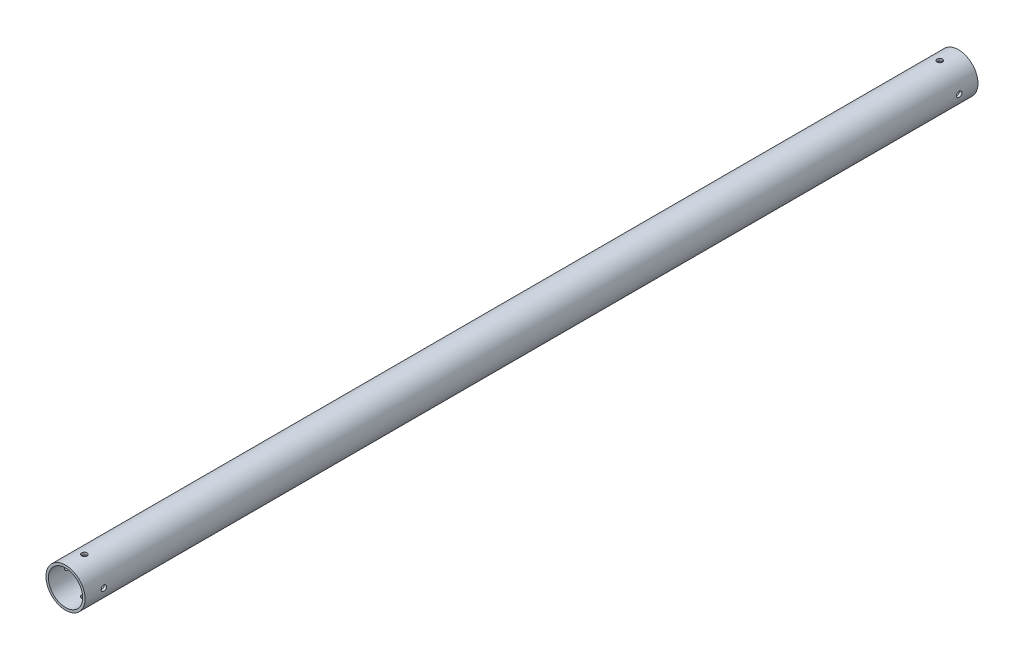
from build123d import *

# Parameters (mm, degrees)
SKETCH2_R               = 12.7
SKETCH2_R_2             = 11.1125
BOSS_EXTRUDE1_DEPTH     = 289.593629981
CUT_EXTRUDE1_DEPTH      = 291.150048295
CUT_EXTRUDE1_DEPTH_BACK = 291.150048295
SKETCH3_R               = 1.7526
CUT_EXTRUDE2_DEPTH      = 291.150048405
CUT_EXTRUDE2_DEPTH_BACK = 291.150048405
SKETCH5_R               = 1.7526


with BuildPart() as part:
    # Sketch2 → Boss-Extrude1 (new, symmetric)
    with BuildSketch(Plane.XY):
        Circle(SKETCH2_R)
        Circle(SKETCH2_R_2, mode=Mode.SUBTRACT)
    extrude(amount=BOSS_EXTRUDE1_DEPTH, both=True)

    # Sketch3 → Cut-Extrude1 (cut, two sides: drawn at the far end of the back side and taken through both)
    with BuildSketch(Plane(origin=(0, 0, 0), x_dir=(1, 0, 0), z_dir=(0, 1, 0)).offset(-CUT_EXTRUDE1_DEPTH_BACK)):
        with Locations((0, 277.401629981)):
            Circle(SKETCH3_R)
        with Locations((0, -277.401629981)):
            Circle(SKETCH3_R)
    extrude(amount=CUT_EXTRUDE1_DEPTH + CUT_EXTRUDE1_DEPTH_BACK, mode=Mode.SUBTRACT)

    # Sketch5 → Cut-Extrude2 (cut, two sides: drawn at the far end of the back side and taken through both)
    with BuildSketch(Plane(origin=(0, 0, 0), x_dir=(0, 0, -1), z_dir=(1, 0, 0)).offset(-CUT_EXTRUDE2_DEPTH_BACK)):
        with Locations((277.401629981, 0)):
            Circle(SKETCH5_R)
        with Locations((-277.401629981, 0)):
            Circle(SKETCH5_R)
    extrude(amount=CUT_EXTRUDE2_DEPTH + CUT_EXTRUDE2_DEPTH_BACK, mode=Mode.SUBTRACT)


solid = part.part
